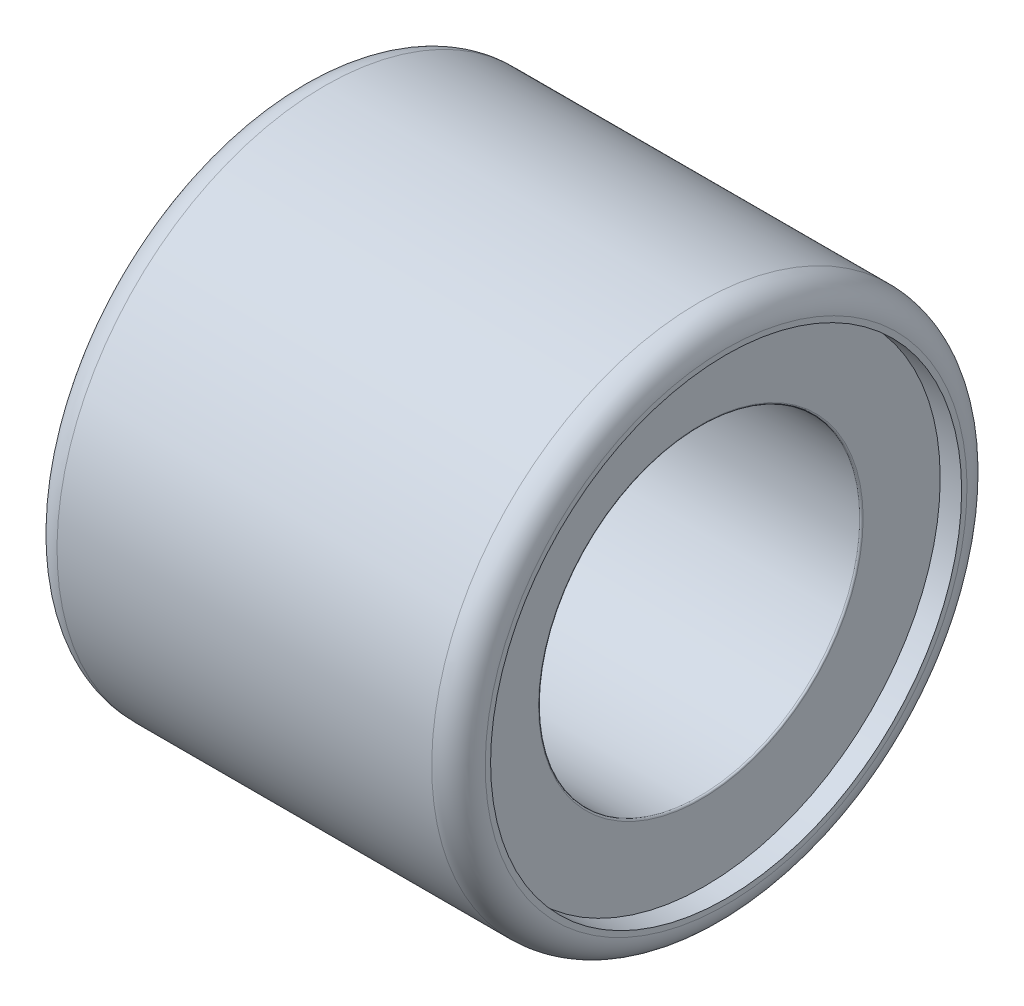
from build123d import *


with BuildPart() as part:
    # InnRacSke → Race (revolve)
    with BuildSketch(Plane.XY):
        with BuildLine():
            Line((-3.6, 4.4), (-4, 4.4))
            Line((-4, 4.4), (-4, 4.5))
            ThreePointArc((-4, 4.5), (-3.853553391, 4.853553391), (-3.5, 5))
            Line((-3.5, 5), (3.5, 5))
            ThreePointArc((3.5, 5), (3.853553391, 4.853553391), (4, 4.5))
            Line((4, 4.5), (4, 4.4))
            Line((4, 4.4), (3.6, 4.4))
            Line((3.6, 4.4), (3.6, 4.6))
            Line((3.6, 4.6), (-3.6, 4.6))
            Line((-3.6, 4.6), (-3.6, 4.4))
        make_face()
    revolve(axis=Axis((-31.75, 0, 0), (1, 0, 0)))

    # RolSimSke → RollersSimplified (revolve)
    with BuildSketch(Plane.XY):
        with BuildLine():
            Line((-3.49598, 4.601), (3.49598, 4.601))
            ThreePointArc((3.49598, 4.601), (3.518621559, 4.591621559), (3.528, 4.56898))
            Line((3.528, 4.56898), (3.528, 3.03202))
            ThreePointArc((3.528, 3.03202), (3.518621559, 3.009378441), (3.49598, 3))
            Line((3.49598, 3), (-3.49598, 3))
            ThreePointArc((-3.49598, 3), (-3.518621559, 3.009378441), (-3.528, 3.03202))
            Line((-3.528, 3.03202), (-3.528, 4.56898))
            ThreePointArc((-3.528, 4.56898), (-3.518621559, 4.591621559), (-3.49598, 4.601))
        make_face()
    revolve(axis=Axis((-25.4, 0, 0), (1, 0, 0)))


solid = part.part
